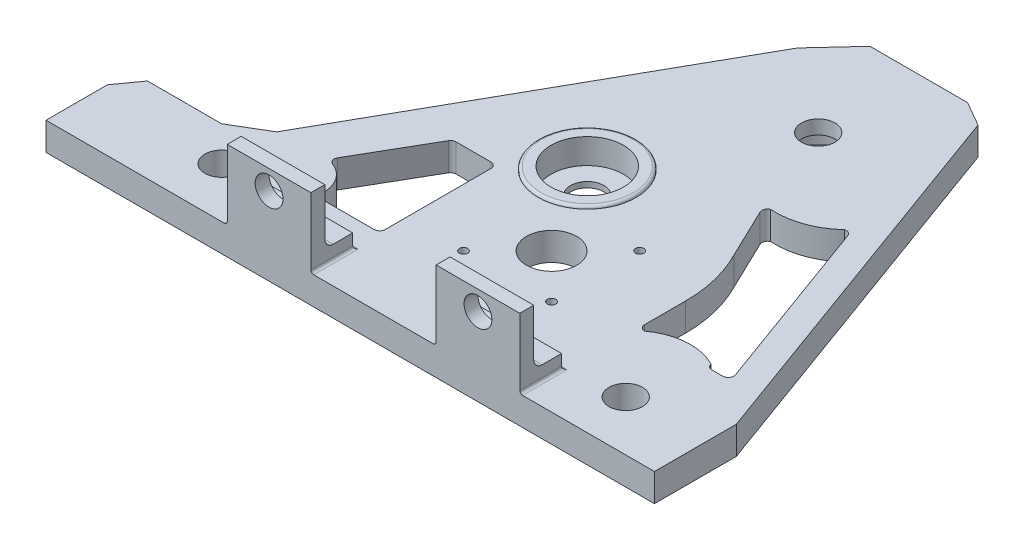
from build123d import *

# Parameters (mm, degrees)
CROQUIS1_R              = 13
CROQUIS1_R_2            = 6
CROQUIS1_R_3            = 9
CROQUIS1_R_4            = 1.5
SALIENTE_EXTRUIR1_DEPTH = 10
CROQUIS2_W              = 30
CROQUIS2_H              = 15
SALIENTE_EXTRUIR2_DEPTH = 5
CROQUIS3_W              = 30
CROQUIS3_H              = 5
SALIENTE_EXTRUIR3_DEPTH = 20
CROQUIS4_R              = 5
CORTAR_EXTRUIR1_DEPTH   = 20
REDONDEO1_R             = 1
REDONDEO2_R             = 1
REDONDEO3_R             = 3
SALIENTE_EXTRUIR4_START = -5
CROQUIS6_R              = 13
CROQUIS6_R_2            = 6
SALIENTE_EXTRUIR4_DEPTH = 5
CROQUIS7_R              = 20
CROQUIS7_R_2            = 13
SALIENTE_EXTRUIR6_DEPTH = 3
REDONDEO5_R             = 3
CROQUIS8_R              = 13
CROQUIS8_R_2            = 6
SALIENTE_EXTRUIR7_DEPTH = 2
CROQUIS9_R              = 17.5
CROQUIS9_R_2            = 13
SALIENTE_EXTRUIR8_DEPTH = 1
REDONDEO6_R             = 1


with BuildPart() as part:
    # Croquis1 → Saliente-Extruir1 (new body)
    with BuildSketch(Plane(origin=(0, 0, 0), x_dir=(1, 0, 0), z_dir=(0, 1, 0))):
        Polygon((-109.095, 0), (109.095, 0), (109.095, 29.37), (59.500415879, 165.63), (50.697846821, 170.712165615), (15.697846821, 170.712165615), (3.225, 157.21), (-64.095, 37.77), (-76.489816261, 30.39), (-103.085, 30.39), (-109.095, 22), align=None)
        with Locations(Location((33.197846821, 134.63, 0), (0, 0, 270))):
            Circle(CROQUIS1_R, mode=Mode.SUBTRACT)
        with Locations(Location((3.225, 81.78, 0), (0, 0, 270))):
            Circle(CROQUIS1_R, mode=Mode.SUBTRACT)
        with Locations(Location((-64.095, 18, 0), (0, 0, 270))):
            Circle(CROQUIS1_R_2, mode=Mode.SUBTRACT)
        with Locations(Location((80.805, 18, 0), (0, 0, 270))):
            Circle(CROQUIS1_R_2, mode=Mode.SUBTRACT)
        with Locations(Location((22.115, 50.09, 0), (0, 0, 270))):
            Circle(CROQUIS1_R_3, mode=Mode.SUBTRACT)
        with Locations(Location((37.905, 65.88, 0), (0, 0, 270))):
            Circle(CROQUIS1_R_4, mode=Mode.SUBTRACT)
        with Locations(Location((37.905, 34.3, 0), (0, 0, 270))):
            Circle(CROQUIS1_R_4, mode=Mode.SUBTRACT)
        with Locations(Location((6.325, 34.3, 0), (0, 0, 270))):
            Circle(CROQUIS1_R_4, mode=Mode.SUBTRACT)
        with BuildLine():
            Line((-34.959241143, 24.905539046), (-16.329241143, 24.905539046))
            ThreePointArc((-16.329241143, 24.905539046), (-14.915027581, 25.491325484), (-14.329241143, 26.905539046))
            Line((-14.329241143, 26.905539046), (-14.329241143, 64.805539046))
            ThreePointArc((-14.329241143, 64.805539046), (-14.915027581, 66.219752609), (-16.329241143, 66.805539046))
            Line((-16.329241143, 66.805539046), (-28.864540605, 66.805539046))
            ThreePointArc((-28.864540605, 66.805539046), (-29.864540605, 66.537589854), (-30.596591412, 65.805539046))
            Line((-30.596591412, 65.805539046), (-45.124461509, 40.642529914))
            ThreePointArc((-45.124461509, 40.642529914), (-45.275154746, 38.967789325), (-44.095, 37.77))
            ThreePointArc((-44.095, 37.77), (-38.917486541, 33.735802046), (-36.959241143, 27.471085475))
            Line((-36.959241143, 27.471085475), (-36.959241143, 26.905539046))
            ThreePointArc((-36.959241143, 26.905539046), (-36.373454706, 25.491325484), (-34.959241143, 24.905539046))
        make_face(mode=Mode.SUBTRACT)
        with BuildLine():
            Line((70.518843068, 107.928122629), (93.592402069, 44.534040287))
            ThreePointArc((93.592402069, 44.534040287), (93.351320916, 42.702847127), (91.713016828, 41.85))
            Line((91.713016828, 41.85), (87.853935228, 41.85))
            ThreePointArc((87.853935228, 41.85), (86.557059698, 42.32746466), (85.879396403, 43.53188614))
            ThreePointArc((85.879396403, 43.53188614), (74.558636842, 45.862576394), (63.719312841, 41.85))
            ThreePointArc((63.719312841, 41.85), (62.305099279, 42.435786438), (61.719312841, 43.85))
            Line((61.719312841, 43.85), (61.719312841, 58.5))
            ThreePointArc((61.719312841, 58.5), (60.302618614, 70.31788476), (56.132816833, 81.466076355))
            Line((56.132816833, 81.466076355), (47.469675424, 99.515111912))
            ThreePointArc((47.469675424, 99.515111912), (47.413687511, 101.118061517), (48.553338923, 102.246678699))
            ThreePointArc((48.553338923, 102.246678699), (59.00154122, 103.684084154), (68.023190025, 109.146768338))
            ThreePointArc((68.023190025, 109.146768338), (69.517034466, 109.041263258), (70.518843068, 107.928122629))
        make_face(mode=Mode.SUBTRACT)
    extrude(amount=SALIENTE_EXTRUIR1_DEPTH)

    # Croquis2 → Saliente-Extruir2 (add)
    with BuildSketch(Plane(origin=(0, 10, 0), x_dir=(1, 0, 0), z_dir=(0, 1, 0))):
        with Locations((-29.095, 7.5)):
            Rectangle(CROQUIS2_W, CROQUIS2_H)
        with Locations((45.805, 7.5)):
            Rectangle(CROQUIS2_W, CROQUIS2_H)
    extrude(amount=SALIENTE_EXTRUIR2_DEPTH)

    # Croquis3 → Saliente-Extruir3 (add)
    with BuildSketch(Plane(origin=(0, 15, 0), x_dir=(1, 0, 0), z_dir=(0, 1, 0))):
        with Locations((-29.095, 2.5)):
            Rectangle(CROQUIS3_W, CROQUIS3_H)
        with Locations((45.805, 2.5)):
            Rectangle(CROQUIS3_W, CROQUIS3_H)
    extrude(amount=SALIENTE_EXTRUIR3_DEPTH)

    # Croquis4 → Cortar-Extruir1 (cut)
    with BuildSketch(Plane(origin=(0, 0, -5), x_dir=(-1, 0, 0), z_dir=(0, 0, -1))):
        with Locations((-45.805, 28)):
            Circle(CROQUIS4_R)
        with Locations((29.095, 28)):
            Circle(CROQUIS4_R)
    extrude(amount=-CORTAR_EXTRUIR1_DEPTH, mode=Mode.SUBTRACT)

    # Redondeo1
    redondeo1_edges = [part.edges().sort_by_distance(p)[0] for p in [
        (-14.095, 10, -7.5),
        (-44.095, 10, -7.5),
        (60.805, 10, -7.5),
        (30.805, 10, -7.5),
    ]]
    fillet(redondeo1_edges, radius=REDONDEO1_R)

    # Redondeo2
    redondeo2_edges = [part.edges().sort_by_distance(p)[0] for p in [
        (45.805, 10, -15),
        (-29.095, 10, -15),
    ]]
    fillet(redondeo2_edges, radius=REDONDEO2_R)

    # Redondeo3
    redondeo3_edges = [part.edges().sort_by_distance(p)[0] for p in [
        (-29.095, 15, -5),
        (45.805, 15, -5),
    ]]
    fillet(redondeo3_edges, radius=REDONDEO3_R)

    # Croquis6 → Saliente-Extruir4 (add)
    with BuildSketch(Plane(origin=(0, 10, 0), x_dir=(1, 0, 0), z_dir=(0, 1, 0)).offset(SALIENTE_EXTRUIR4_START)):
        with Locations(Location((33.197846821, 134.63, 0), (0, 0, 270))):
            Circle(CROQUIS6_R)
        with Locations(Location((33.197846821, 134.63, 0), (0, 0, 270))):
            Circle(CROQUIS6_R_2, mode=Mode.SUBTRACT)
    extrude(amount=SALIENTE_EXTRUIR4_DEPTH)

    # Croquis8 → Saliente-Extruir7 (add)
    with BuildSketch(Plane.XZ):
        with Locations(Location((3.225, -81.78, 0), (0, 0, 270))):
            Circle(CROQUIS8_R)
        with Locations(Location((3.225, -81.78, 0), (0, 0, 270))):
            Circle(CROQUIS8_R_2, mode=Mode.SUBTRACT)
    extrude(amount=-SALIENTE_EXTRUIR7_DEPTH)

    # Croquis9 → Saliente-Extruir8 (add)
    with BuildSketch(Plane(origin=(0, 10, 0), x_dir=(1, 0, 0), z_dir=(0, 1, 0))):
        with Locations(Location((3.225, 81.78, 0), (0, 0, 270))):
            Circle(CROQUIS9_R)
        with Locations(Location((3.225, 81.78, 0), (0, 0, 90))):
            Circle(CROQUIS9_R_2, mode=Mode.SUBTRACT)
    extrude(amount=SALIENTE_EXTRUIR8_DEPTH)

    # Redondeo6
    redondeo6_edges = [part.edges().sort_by_distance(p)[0] for p in [
        (3.225, 11, -99.28),
    ]]
    fillet(redondeo6_edges, radius=REDONDEO6_R - 0.0001)  # a hair under: the kernel refuses the full size


with BuildPart() as body_2:
    # Croquis7 → Saliente-Extruir6 (new body)
    with BuildSketch(Plane.XZ):
        with Locations(Location((33.197846821, -134.63, 0), (0, 0, 270))):
            Circle(CROQUIS7_R)
        with Locations(Location((33.197846821, -134.63, 0), (0, 0, 270))):
            Circle(CROQUIS7_R_2, mode=Mode.SUBTRACT)
    extrude(amount=SALIENTE_EXTRUIR6_DEPTH)

    # Redondeo5
    redondeo5_edges = [body_2.edges().sort_by_distance(p)[0] for p in [
        (33.197846821, -3, -114.63),
    ]]
    fillet(redondeo5_edges, radius=REDONDEO5_R - 0.0001)  # a hair under: the kernel refuses the full size


solid = Compound([part.part, body_2.part])
